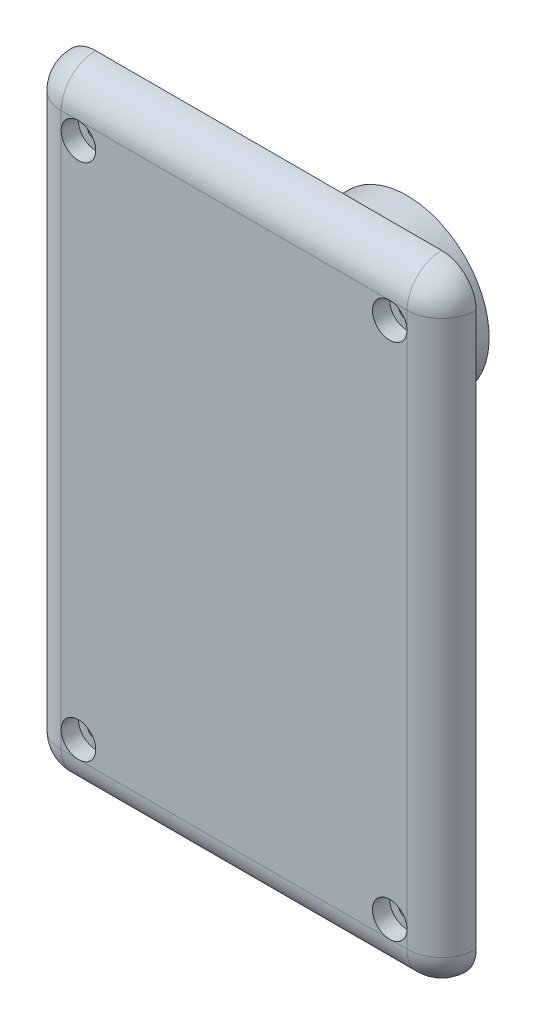
from build123d import *

# Parameters (mm, degrees)
SKETCH_1_W          = 24
SKETCH_1_H          = 36
EXTRUDE_1_DEPTH     = 2
FILLET_1_R          = 2
SKETCH_4_R          = 2.05
CUT_EXTRUDE_1_DEPTH = 1
SKETCH_7_R          = 4.75
SKETCH_7_R_2        = 4
EXTRUDE_2_DEPTH     = 4
CUT_EXTRUDE_2_DEPTH = 4
SKETCH_9_R          = 1
CUT_EXTRUDE_3_DEPTH = 1
CUT_EXTRUDE_4_REACH = 146.567
SKETCH_10_R         = 0.5
EXTRUDE_3_DEPTH     = 4


with BuildPart() as part:
    # 草图1 → 凸台-拉伸1 (new body)
    with BuildSketch(Plane.XY):
        with Locations((-109.790086771, 59.72858385)):
            Rectangle(SKETCH_1_W, SKETCH_1_H)
    extrude(amount=EXTRUDE_1_DEPTH)

    # 圆角1
    fillet_1_edges = [part.edges().sort_by_distance(p)[0] for p in [
        (-121.790086771, 59.72858385, 2),
        (-109.790086771, 41.72858385, 2),
        (-97.790086771, 59.72858385, 2),
        (-97.790086771, 41.72858385, 1),
        (-121.790086771, 41.72858385, 1),
        (-121.790086771, 77.72858385, 1),
        (-97.790086771, 77.72858385, 1),
        (-109.790086771, 77.72858385, 2),
    ]]
    fillet(fillet_1_edges, radius=FILLET_1_R - 0.0001)  # a hair under: the kernel refuses the full size

    # 草图4 → 切除-拉伸1 (cut)
    with BuildSketch(Plane(origin=(0, 0, 0), x_dir=(-1, 0, 0), z_dir=(0, 0, -1))):
        with Locations((117.420086771, 66.20858385)):
            Circle(SKETCH_4_R)
    extrude(amount=-CUT_EXTRUDE_1_DEPTH, mode=Mode.SUBTRACT)

    # 草图7 → 凸台-拉伸2 (add)
    with BuildSketch(Plane(origin=(0, 0, 0), x_dir=(-1, 0, 0), z_dir=(0, 0, -1))):
        with Locations((105.790086771, 70.72858385)):
            Circle(SKETCH_7_R)
        with Locations((105.790086771, 70.72858385)):
            Circle(SKETCH_7_R_2, mode=Mode.SUBTRACT)
    extrude(amount=EXTRUDE_2_DEPTH)

    # 草图8 → 切除-拉伸2 (cut)
    with BuildSketch(Plane(origin=(0, 0, -4), x_dir=(-1, 0, 0), z_dir=(0, 0, -1))):
        Polygon((107.295042198, 64.806439923), (104.296751001, 64.705198151), (104.296751001, 67.705198151), (107.295042198, 67.705198151), align=None)
    extrude(amount=-CUT_EXTRUDE_2_DEPTH, mode=Mode.SUBTRACT)

    # 草图9 → 切除-拉伸3 (cut)
    with BuildSketch(Plane.XY.offset(2)):
        with Locations((-100.790086771, 74.72858385)):
            Circle(SKETCH_9_R)
        with Locations((-100.790086771, 44.72858385)):
            Circle(SKETCH_9_R)
        with Locations((-118.790086771, 44.72858385)):
            Circle(SKETCH_9_R)
        with Locations((-118.790086771, 74.72858385)):
            Circle(SKETCH_9_R)
    extrude(amount=-CUT_EXTRUDE_3_DEPTH, mode=Mode.SUBTRACT)

    # 草图10 → 切除-拉伸4 (cut, up to next)
    with BuildSketch(Plane.XY.offset(1), mode=Mode.PRIVATE) as cut_extrude_4_sk1:
        with Locations((-118.790086771, 44.72858385)):
            Circle(SKETCH_10_R)
    cut_extrude_4_tool1 = extrude(cut_extrude_4_sk1.sketch, amount=-CUT_EXTRUDE_4_REACH, mode=Mode.PRIVATE) & part.part
    # 草图10 → 切除-拉伸4 (cut, up to next)
    with BuildSketch(Plane.XY.offset(1), mode=Mode.PRIVATE) as cut_extrude_4_sk2:
        with Locations((-100.790086771, 44.72858385)):
            Circle(SKETCH_10_R)
    cut_extrude_4_tool2 = extrude(cut_extrude_4_sk2.sketch, amount=-CUT_EXTRUDE_4_REACH, mode=Mode.PRIVATE) & part.part
    # 草图10 → 切除-拉伸4 (cut, up to next)
    with BuildSketch(Plane.XY.offset(1), mode=Mode.PRIVATE) as cut_extrude_4_sk3:
        with Locations((-100.790086771, 74.72858385)):
            Circle(SKETCH_10_R)
    cut_extrude_4_tool3 = extrude(cut_extrude_4_sk3.sketch, amount=-CUT_EXTRUDE_4_REACH, mode=Mode.PRIVATE) & part.part
    # 草图10 → 切除-拉伸4 (cut, up to next)
    with BuildSketch(Plane.XY.offset(1), mode=Mode.PRIVATE) as cut_extrude_4_sk4:
        with Locations((-118.790086771, 74.72858385)):
            Circle(SKETCH_10_R)
    cut_extrude_4_tool4 = extrude(cut_extrude_4_sk4.sketch, amount=-CUT_EXTRUDE_4_REACH, mode=Mode.PRIVATE) & part.part
    add(cut_extrude_4_tool1.solids().sort_by_distance((-118.790087, 44.728584, 1))[0], mode=Mode.SUBTRACT)
    add(cut_extrude_4_tool2.solids().sort_by_distance((-100.790087, 44.728584, 1))[0], mode=Mode.SUBTRACT)
    add(cut_extrude_4_tool3.solids().sort_by_distance((-100.790087, 74.728584, 1))[0], mode=Mode.SUBTRACT)
    add(cut_extrude_4_tool4.solids().sort_by_distance((-118.790087, 74.728584, 1))[0], mode=Mode.SUBTRACT)

    # 草图12 → 凸台-拉伸3 (add)
    with BuildSketch(Plane(origin=(0, 0, 0), x_dir=(-1, 0, 0), z_dir=(0, 0, -1))):
        with BuildLine():
            Line((108.145924466, 66.861652665), (111.46923478, 59.734790696))
            ThreePointArc((111.46923478, 59.734790696), (111.253339507, 59.141623309), (110.66017212, 59.357518582))
            Line((110.66017212, 59.357518582), (107.336861805, 66.484380551))
            ThreePointArc((107.336861805, 66.484380551), (107.552757078, 67.077547938), (108.145924466, 66.861652665))
        make_face()
    extrude(amount=EXTRUDE_3_DEPTH)


solid = part.part
